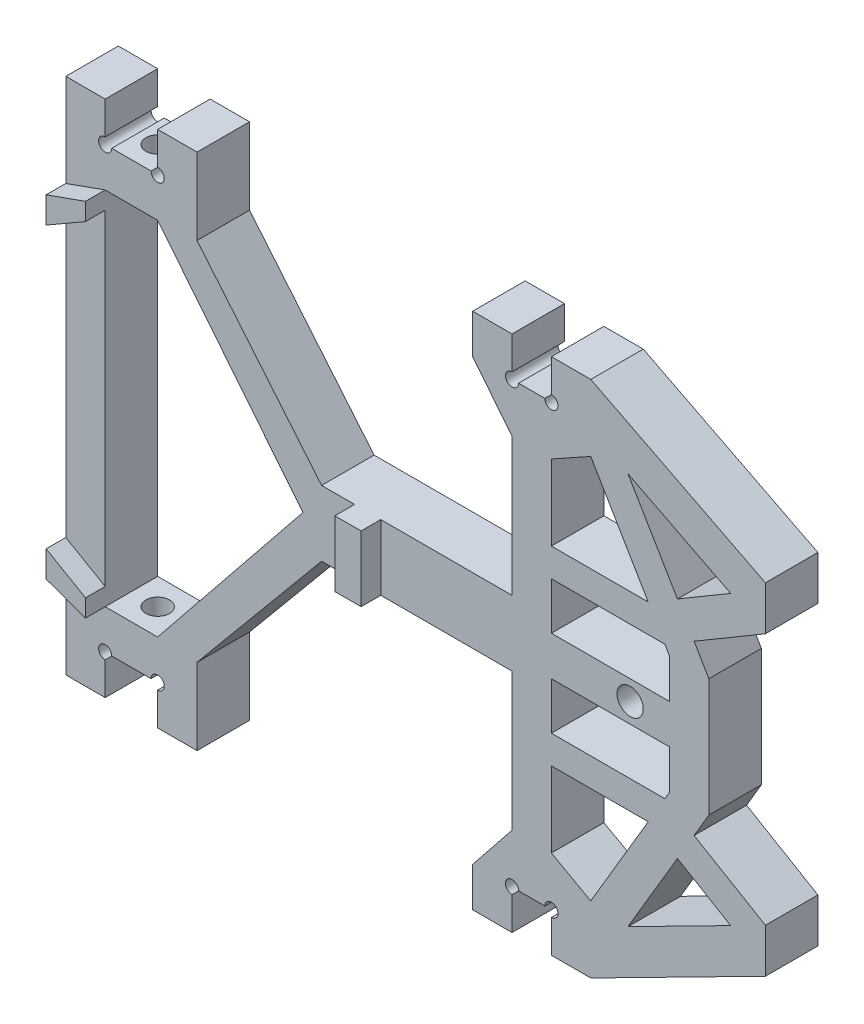
from build123d import *

# Parameters (mm, degrees)
EXTRUDE_1_DEPTH     = 4
SKETCH_2_R          = 0.9
CUT_EXTRUDE_1_DEPTH = 52
SKETCH_3_W          = 2.000000328
SKETCH_3_H          = 4.999999888
EXTRUDE_2_DEPTH     = 1.5
EXTRUDE_3_DEPTH     = 4
CUT_EXTRUDE_3_DEPTH = 4
SKETCH_7_R          = 1
CUT_EXTRUDE_4_DEPTH = 8


with BuildPart() as part:
    # 草图1 → 凸台-拉伸1 (new body)
    with BuildSketch(Plane.XY):
        with BuildLine():
            Line((66.000003368, -0.999999465), (66.000003368, 1.000000862))
            ThreePointArc((66.000003368, 1.000000862), (65.646447605, 1.853552596), (66.500000656, 1.500000013))
            Line((66.500000656, 1.500000013), (69.000001997, 1.500000013))
            Line((69.000001997, 1.500000013), (69.000001997, 4.999999655))
            Line((69.000001997, 4.999999655), (40.0000019, 19.749999745))
            Line((40.0000019, 19.749999745), (37.000001874, 19.749999745))
            Line((37.000001874, 19.749999745), (37.000001874, 17.250002129))
            ThreePointArc((37.000001874, 17.250002129), (37.353555819, 16.396448761), (36.500001792, 16.750001116))
            Line((36.500001792, 16.750001116), (34.500001871, 16.750001116))
            ThreePointArc((34.500001871, 16.750001116), (33.646447808, 16.396448765), (34.000001848, 17.250002129))
            Line((34.000001848, 17.250002129), (34.000001848, 19.749999745))
            Line((34.000001848, 19.749999745), (31.000001822, 19.749999745))
            Line((31.000001822, 19.749999745), (31.000001822, 16.750001116))
            Line((31.000001822, 16.750001116), (34.000001848, 13.000000967))
            Line((34.000001848, 13.000000967), (34.000001848, 2.500000177))
            Line((34.000001848, 2.500000177), (19.492642954, 2.500000177))
            Line((19.492642954, 2.500000177), (10.000001639, 13.915917603))
            Line((10.000001639, 13.915917603), (10.000001639, 19.749999745))
            Line((10.000001639, 19.749999745), (7.000001147, 19.749999745))
            Line((7.000001147, 19.749999745), (7.000001147, 17.250002129))
            ThreePointArc((7.000001147, 17.250002129), (7.353556004, 16.396449439), (6.500001997, 16.750001116))
            Line((6.500001997, 16.750001116), (3.500001505, 16.750001116))
            ThreePointArc((3.500001505, 16.750001116), (2.646447808, 16.396449749), (3.000002354, 17.250002129))
            Line((3.000002354, 17.250002129), (3.000002354, 19.749999745))
            Line((3.000002354, 19.749999745), (0, 19.749999745))
            Line((0, 19.749999745), (0, -19.749999745))
            Line((0, -19.749999745), (3.000002354, -19.749999745))
            Line((3.000002354, -19.749999745), (3.000002354, -17.249999742))
            ThreePointArc((3.000002354, -17.249999742), (2.646448465, -16.39644732), (3.500001505, -16.749999719))
            Line((3.500001505, -16.749999719), (6.500001997, -16.749999719))
            ThreePointArc((6.500001997, -16.749999719), (7.353555348, -16.396447009), (7.000001147, -17.249999742))
            Line((7.000001147, -17.249999742), (7.000001147, -19.749999745))
            Line((7.000001147, -19.749999745), (10.000001639, -19.749999745))
            Line((10.000001639, -19.749999745), (10.000001639, -13.915917138))
            Line((10.000001639, -13.915917138), (19.492642954, -2.499999711))
            Line((19.492642954, -2.499999711), (34.000001848, -2.499999711))
            Line((34.000001848, -2.499999711), (34.000001848, -12.999999803))
            Line((34.000001848, -12.999999803), (31.000001822, -16.749999719))
            Line((31.000001822, -16.749999719), (31.000001822, -19.749999745))
            Line((31.000001822, -19.749999745), (34.000001848, -19.749999745))
            Line((34.000001848, -19.749999745), (34.000001848, -17.249999742))
            ThreePointArc((34.000001848, -17.249999742), (33.646448464, -16.396446335), (34.500001871, -16.749999719))
            Line((34.500001871, -16.749999719), (36.500001792, -16.749999719))
            ThreePointArc((36.500001792, -16.749999719), (37.353555162, -16.396446331), (37.000001874, -17.249999742))
            Line((37.000001874, -17.249999742), (37.000001874, -19.749999745))
            Line((37.000001874, -19.749999745), (40.0000019, -19.749999745))
            Line((40.0000019, -19.749999745), (69.000001997, -5.000000121))
            Line((69.000001997, -5.000000121), (69.000001997, -1.499999547))
            Line((69.000001997, -1.499999547), (66.500000656, -1.499999547))
            ThreePointArc((66.500000656, -1.499999547), (65.646447327, -1.853550818), (66.000003368, -0.999999465))
        make_face()
        Polygon((37.000001874, 13.000000967), (37.000001874, 1.500000013), (46.000001952, 1.500000013), (46.000001952, 4.500000505), (40.0000019, 14.666666044), align=None, mode=Mode.SUBTRACT)
        Polygon((42.838321999, -14.940624125), (49.000001512, -4.500000039), (49.000001512, -1.499999547), (63.000001013, -1.499999547), (64.000001177, -4.17735544), align=None, mode=Mode.SUBTRACT)
        Polygon((46.000001952, -1.499999547), (37.000001874, -1.499999547), (37.000001874, -12.999999803), (40.0000019, -14.666666277), (46.000001952, -4.500000039), align=None, mode=Mode.SUBTRACT)
        Polygon((63.000001013, 1.500000013), (64.000001177, 4.177356837), (42.838321999, 14.940623892), (49.000001512, 4.500000505), (49.000001512, 1.500000013), align=None, mode=Mode.SUBTRACT)
        Polygon((3.000002354, -13.749999693), (7.000001147, -13.749999693), (18.065146907, -1.59e-07), (7.000001147, 13.750000624), (3.000002354, 13.750000624), align=None, mode=Mode.SUBTRACT)
    extrude(amount=EXTRUDE_1_DEPTH)

    # 草图2 → 切除-拉伸1 (cut)
    with BuildSketch(Plane.XZ.offset(16.749999719)):
        with Locations((5.000002354, 2)):
            Circle(SKETCH_2_R)
    extrude(amount=-CUT_EXTRUDE_1_DEPTH, mode=Mode.SUBTRACT)

    # 草图3 → 凸台-拉伸2 (add)
    with BuildSketch(Plane.XY.offset(4)):
        Polygon((3.000002354, 12.413031189), (3.000002354, 13.750000624), (0, 12.680980144), (0, 10.680979816), align=None)
        with Locations((23.000001907, 2.33e-07)):
            Rectangle(SKETCH_3_W, SKETCH_3_H)
        Polygon((3.000002354, -13.749999693), (3.000002354, -12.413030723), (0, -10.680979816), (0, -12.680979678), align=None)
    extrude(amount=EXTRUDE_2_DEPTH)

    # 草图5 → 凸台-拉伸3 (add)
    with BuildSketch(Plane.XY):
        Polygon((37.000001874, 7.25000049), (44.377050947, 7.25000049), (50.66399207, 10.960326481), (53.305912072, 9.616591408), (45.647685021, 5.0969819), (37.000001874, 5.0969819), align=None)
        Polygon((37.000001874, -5.0969819), (45.647685021, -5.0969819), (53.305912072, -9.616591408), (50.66399207, -10.960326481), (44.377050947, -7.25000049), (37.000001874, -7.25000049), align=None)
    extrude(amount=EXTRUDE_3_DEPTH)

    # 草图6 → 切除-拉伸3 (cut)
    with BuildSketch(Plane.XY.offset(4)):
        Polygon((53.305912072, 9.616591408), (53.305912072, 18.733414993), (82.339111623, 18.733414993), (82.339111623, -18.733414993), (53.305912072, -18.733414993), (53.305912072, -9.616591408), (47.872719428, -6.410116989), (49.000001512, -4.500000039), (49.000001512, 4.500000505), (47.872719576, 6.410117076), align=None)
    extrude(amount=-CUT_EXTRUDE_3_DEPTH, mode=Mode.SUBTRACT)

    # 草图7 → 切除-拉伸4 (cut)
    with BuildSketch(Plane.XY.offset(4)):
        with Locations((43.000001512, 0)):
            Circle(SKETCH_7_R)
    extrude(amount=-CUT_EXTRUDE_4_DEPTH, mode=Mode.SUBTRACT)


solid = part.part
